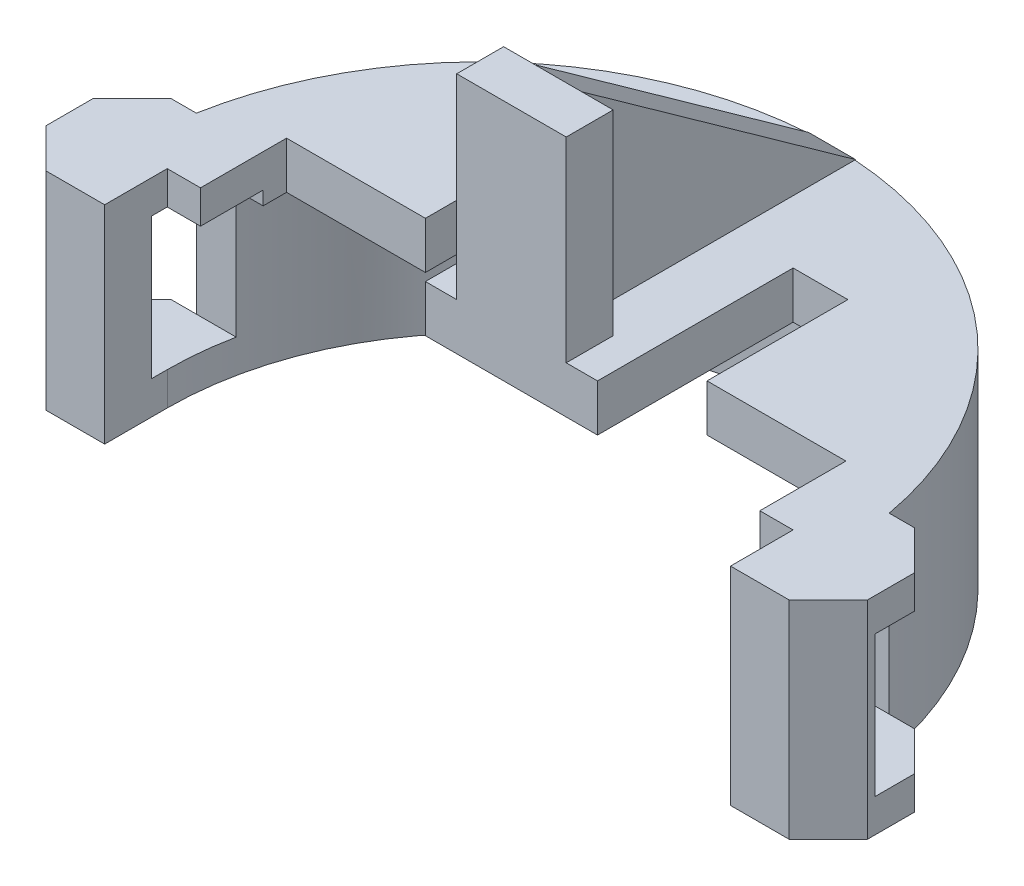
from build123d import *

# Parameters (mm, degrees)
REVOLVE1_ANGLE      = 180
SKETCH2_W           = 6.21
SKETCH2_H           = 1.5
CUT_EXTRUDE1_DEPTH  = 14.787313009
CUT_EXTRUDE2_DEPTH  = 14.787313009
SKETCH4_W           = 3.4
SKETCH4_H           = 2
BOSS_EXTRUDE1_DEPTH = 1.2
SKETCH6_W           = 2.8
SKETCH6_H           = 5
BOSS_EXTRUDE3_DEPTH = 1.2
BOSS_EXTRUDE4_DEPTH = 0.6
CUT_EXTRUDE3_DEPTH  = 10
SKETCH5_W           = 3.2
SKETCH5_H           = 5.3
BOSS_EXTRUDE5_DEPTH = 2.5
SKETCH9_W           = 2
SKETCH9_H           = 3.6
CUT_EXTRUDE4_DEPTH  = 5
CHAMFER1_SIZE       = 1


with BuildPart() as part:
    # Sketch1 → Revolve1 (revolve)
    with BuildSketch(Plane.XY):
        Polygon((8, 4.1), (8, 0), (9, 0), (9, 5.3), (0, 5.3), (0, 4.1), align=None)
    revolve(axis=Axis((0, 0, 0), (0, 1, 0)), revolution_arc=REVOLVE1_ANGLE)

    # Sketch2 → Cut-Extrude1 (cut, through all)
    with BuildSketch(Plane.XY):
        with Locations((0, 3.35)):
            Rectangle(SKETCH2_W, SKETCH2_H)
    extrude(amount=-CUT_EXTRUDE1_DEPTH, mode=Mode.SUBTRACT)

    # Sketch3 → Cut-Extrude2 (cut, through all)
    with BuildSketch(Plane(origin=(0, 5.3, 0), x_dir=(1, 0, 0), z_dir=(0, 1, 0))):
        Polygon((-2.2, 5.8), (-3.6, 5.8), (-3.6, 0), (3.6, 0), (3.6, 5.8), (2.2, 5.8), (2.2, 0.8), (-2.2, 0.8), align=None)
    extrude(amount=-CUT_EXTRUDE2_DEPTH, mode=Mode.SUBTRACT)

    # Sketch4 → Boss-Extrude1 (add)
    with BuildSketch(Plane(origin=(0, 5.3, 0), x_dir=(1, 0, 0), z_dir=(0, 1, 0))):
        with Locations((5.3, -1)):
            Rectangle(SKETCH4_W, SKETCH4_H)
        with Locations((-5.3, -1)):
            Rectangle(SKETCH4_W, SKETCH4_H)
    extrude(amount=-BOSS_EXTRUDE1_DEPTH)

    # Sketch6 → Boss-Extrude3 (add)
    with BuildSketch(Plane.XY.offset(-0.8)):
        with Locations((0, 7.8)):
            Rectangle(SKETCH6_W, SKETCH6_H)
    extrude(amount=-BOSS_EXTRUDE3_DEPTH)

    # Sketch7 → Boss-Extrude4 (add, symmetric)
    with BuildSketch(Plane(origin=(0, 0, 0), x_dir=(0, 0, -1), z_dir=(1, 0, 0))):
        Polygon((2, 10.3), (9, 5.3), (2, 5.3), align=None)
    extrude(amount=BOSS_EXTRUDE4_DEPTH, both=True)

    # Sketch8 → Cut-Extrude3 (cut)
    with BuildSketch(Plane(origin=(0, 5.3, 0), x_dir=(1, 0, 0), z_dir=(0, 1, 0))):
        Polygon((7.15, 2.2), (2.5, 2.2), (2.5, 0), (-3.6, 0), (-3.6, 2.2), (-7.15, 2.2), (-7.15, -4.40240097), (9.554991512, -4.40240097), (9.554991512, 0), (7.15, 0), align=None)
    extrude(amount=-CUT_EXTRUDE3_DEPTH, mode=Mode.SUBTRACT)

    # Sketch5 → Boss-Extrude5 (add)
    with BuildSketch(Plane(origin=(8, 0, 0), x_dir=(0, 0, -1), z_dir=(1, 0, 0))):
        with Locations((0, 2.65)):
            Rectangle(SKETCH5_W, SKETCH5_H)
    boss_extrude5 = extrude(amount=BOSS_EXTRUDE5_DEPTH)

    # Sketch9 → Cut-Extrude4 (cut)
    with BuildSketch(Plane(origin=(10.5, 0, 0), x_dir=(0, 0, -1), z_dir=(1, 0, 0))):
        with Locations((0.6, 2.65)):
            Rectangle(SKETCH9_W, SKETCH9_H)
    cut_extrude4 = extrude(amount=-CUT_EXTRUDE4_DEPTH, mode=Mode.SUBTRACT)

    # Mirror1: Boss-Extrude5, Cut-Extrude4 across plane
    add(boss_extrude5.mirror(Plane(origin=(0, 0, 0), x_dir=(0, 0, 1), z_dir=(1, 0, 0))))
    add(cut_extrude4.mirror(Plane(origin=(0, 0, 0), x_dir=(0, 0, 1), z_dir=(1, 0, 0))), mode=Mode.SUBTRACT)

    # Chamfer1
    chamfer1_edges = [part.edges().sort_by_distance(p)[0] for p in [
        (-10.5, 0.425, -1.6),
        (-10.5, 4.875, -1.6),
        (-10.5, 2.65, 1.6),
        (10.5, 0.425, -1.6),
        (10.5, 4.875, -1.6),
        (10.5, 2.65, 1.6),
    ]]
    chamfer(chamfer1_edges, length=CHAMFER1_SIZE)


solid = part.part
